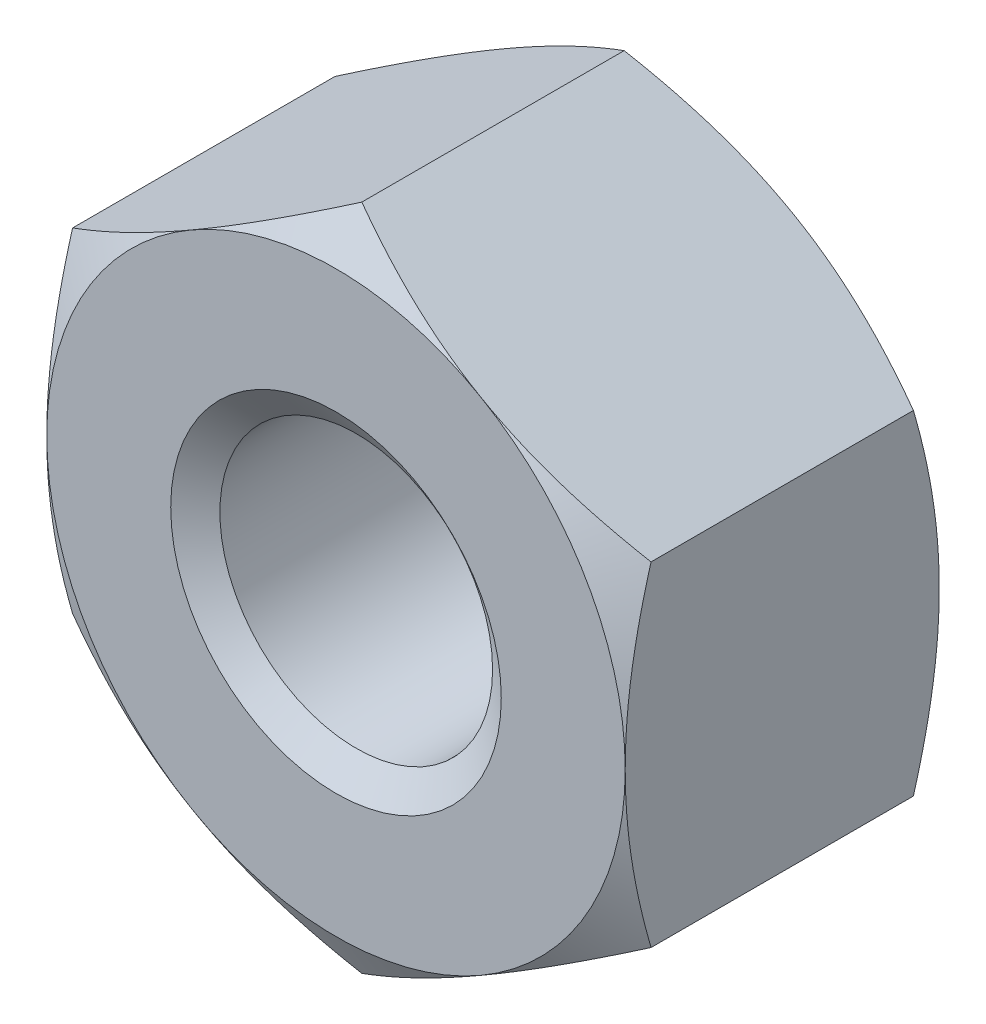
from build123d import *

# Parameters (mm, degrees)
BASENUT_START = -3.8
BASENUTSKE_R  = 1.65
BASENUT_DEPTH = 3.8
SCALA1_SCALE  = 1.05


# Read off the part's stored shape, not the designer's step: ThreadSchematic
with BuildPart() as part:
    # BaseNutSke → BaseNut (new body)
    with BuildSketch(Plane.XY.offset(BASENUT_START)):
        Polygon((3.5, 2.020725942), (3.5, -2.020725942), (0, -4.041451884), (-3.5, -2.020725942), (-3.5, 2.020725942), (0, 4.041451884), align=None)
        Circle(BASENUTSKE_R, mode=Mode.SUBTRACT)
    extrude(amount=BASENUT_DEPTH)

    # Sketch5 (on Front Plane) → EndChamfer (revolve, cut)
    with BuildSketch(Plane.XY):
        Polygon((3.7746, 2), (3.505020098, 1.615), (3.8254, 1.615), (3.8254, 2), align=None)
    revolve(axis=Axis((3.7746, 2, 0), (-0.5735764363510472, -0.8191520442889912, 0)), mode=Mode.SUBTRACT)

    # Sketch3 → Double-Chamfer (revolve, cut)
    with BuildSketch(Plane(origin=(0, 0, 0), x_dir=(0, 0, -1), z_dir=(1, 0, 0))):
        Polygon((3.8, 3.5), (3.487392609, 4.041451884), (3.487392609, 14.041451884), (13.8, 14.041451884), (13.8, 3.5), align=None)
        Polygon((0.312607391, 14.041451884), (-10, 14.041451884), (-10, 3.5), (0, 3.5), (0.312607391, 4.041451884), align=None)
    revolve(axis=Axis((0, 0, 0), (0, 0, -1)), mode=Mode.SUBTRACT)

    # ThreadSchematic outline → ThreadSchematic (revolve, cut)
    with BuildSketch(Plane.XZ):
        Polygon((1.65, 0), (1.65, -0.245072638), (2, 0), align=None)
        Polygon((2, -3.7746), (1.65, -3.529527362), (1.65, -3.8), (2, -3.8), align=None)
    revolve(axis=Axis((0, 0, 0), (0, 0, 1)), mode=Mode.SUBTRACT)


with BuildPart() as part_1:
    # Scala1: scaled about (0, 0, -1.898579805)
    add(part.part.scale(SCALA1_SCALE).moved(Location((0, 0, 0.09492899))))


solid = part_1.part
